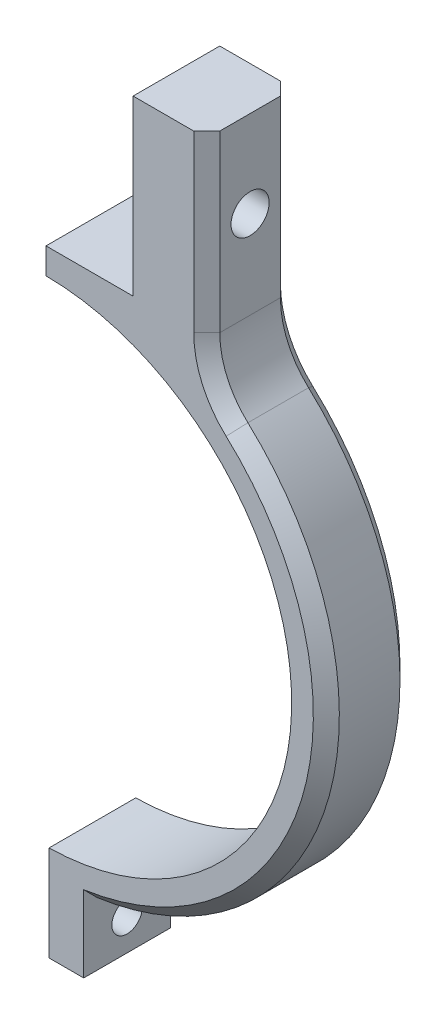
from build123d import *

# Parameters (mm, degrees)
AUFSATZ_LINEAR_AUSTRAGEN1_DEPTH = 10
SKIZZE2_R                       = 1.75
SCHNITT_LINEAR_AUSTRAGEN1_DEPTH = 65.196962545
SKIZZE4_R                       = 2.2
SCHNITT_LINEAR_AUSTRAGEN3_DEPTH = 74.305456823
VERRUNDUNG1_R                   = 10
SKIZZE5_W                       = 5.5
SKIZZE5_H                       = 5.5
SCHNITT_LINEAR_AUSTRAGEN4_DEPTH = 2
FASE1_SIZE                      = 1.5
SCHNITT_LINEAR_AUSTRAGEN5_DEPTH = 62.713045622


with BuildPart() as part:
    # Skizze1 → Aufsatz-Linear austragen1 (new body)
    with BuildSketch(Plane.XY):
        with BuildLine():
            Line((0.5, -28.495613698), (0.5, -32.496153619))
            Line((0.5, -32.496153619), (0.5, -39.496153619))
            Line((0.5, -39.496153619), (4.5, -39.496153619))
            Line((4.5, -39.496153619), (4.5, -32.186953879))
            ThreePointArc((4.5, -32.186953879), (31.590882714, -7.633225356), (18.7, 26.581196361))
            Line((18.7, 26.581196361), (18.7, 51.5))
            Line((18.7, 51.5), (10.2, 51.5))
            Line((10.2, 51.5), (10.2, 31.5))
            Line((10.2, 31.5), (-10.2, 31.5))
            Line((-10.2, 31.5), (-10.2, 51.5))
            Line((-10.2, 51.5), (-18.7, 51.5))
            Line((-18.7, 51.5), (-18.7, 26.581196361))
            ThreePointArc((-18.7, 26.581196361), (-31.590882714, -7.633225356), (-4.5, -32.186953879))
            Line((-4.5, -32.186953879), (-4.5, -39.496153619))
            Line((-4.5, -39.496153619), (-0.5, -39.496153619))
            Line((-0.5, -39.496153619), (-0.5, -32.496153619))
            Line((-0.5, -32.496153619), (-0.5, -28.495613698))
            ThreePointArc((-0.5, -28.495613698), (0, 28.5), (0.5, -28.495613698))
        make_face()
    extrude(amount=AUFSATZ_LINEAR_AUSTRAGEN1_DEPTH)

    # Skizze2 → Schnitt-Linear austragen1 (cut, through all)
    with BuildSketch(Plane.ZY.offset(4.5)):
        with Locations((5, -35.841553749)):
            Circle(SKIZZE2_R)
    extrude(amount=-SCHNITT_LINEAR_AUSTRAGEN1_DEPTH, mode=Mode.SUBTRACT)

    # Skizze4 → Schnitt-Linear austragen3 (cut, through all)
    with BuildSketch(Plane.ZY.offset(18.7)):
        with Locations((5, 41.5)):
            Circle(SKIZZE4_R)
    extrude(amount=-SCHNITT_LINEAR_AUSTRAGEN3_DEPTH, mode=Mode.SUBTRACT)

    # Verrundung1
    verrundung1_edges = [part.edges().sort_by_distance(p)[0] for p in [
        (18.7, 26.581196361, 5),
        (-18.7, 26.581196361, 5),
    ]]
    fillet(verrundung1_edges, radius=VERRUNDUNG1_R)

    # Skizze5 → Schnitt-Linear austragen4 (cut)
    with BuildSketch(Plane.ZY.offset(4.5)):
        with Locations((5, -35.841553749)):
            Rectangle(SKIZZE5_W, SKIZZE5_H)
    extrude(amount=-SCHNITT_LINEAR_AUSTRAGEN4_DEPTH, mode=Mode.SUBTRACT)

    # Fase1
    fase1_edges = [part.edges().sort_by_distance(p)[0] for p in [
        (-18.7, 41.422906559, 0),
        (-19.547693958, 27.316508696, 0),
        (-31.036620275, -9.642520517, 0),
        (18.7, 41.422906559, 0),
        (19.547693958, 27.316508696, 0),
        (31.036620275, -9.642520517, 0),
        (-18.7, 41.422906559, 10),
        (-19.547693958, 27.316508696, 10),
        (-31.036620275, -9.642520517, 10),
        (18.7, 41.422906559, 10),
        (19.547693958, 27.316508696, 10),
        (31.036620275, -9.642520517, 10),
    ]]
    chamfer(fase1_edges, length=FASE1_SIZE)

    # Skizze6 → Schnitt-Linear austragen5 (cut, through all)
    with BuildSketch(Plane.XY):
        Polygon((0, -82.914559746), (0, 27.830541285), (0.15, 27.830541285), (0.15, 32.208374164), (0, 32.208374164), (0, 82.914559746), (-62.169798489, 71.020337849), (-62.169798489, -54.918482242), align=None)
    extrude(amount=SCHNITT_LINEAR_AUSTRAGEN5_DEPTH, mode=Mode.SUBTRACT)


solid = part.part
